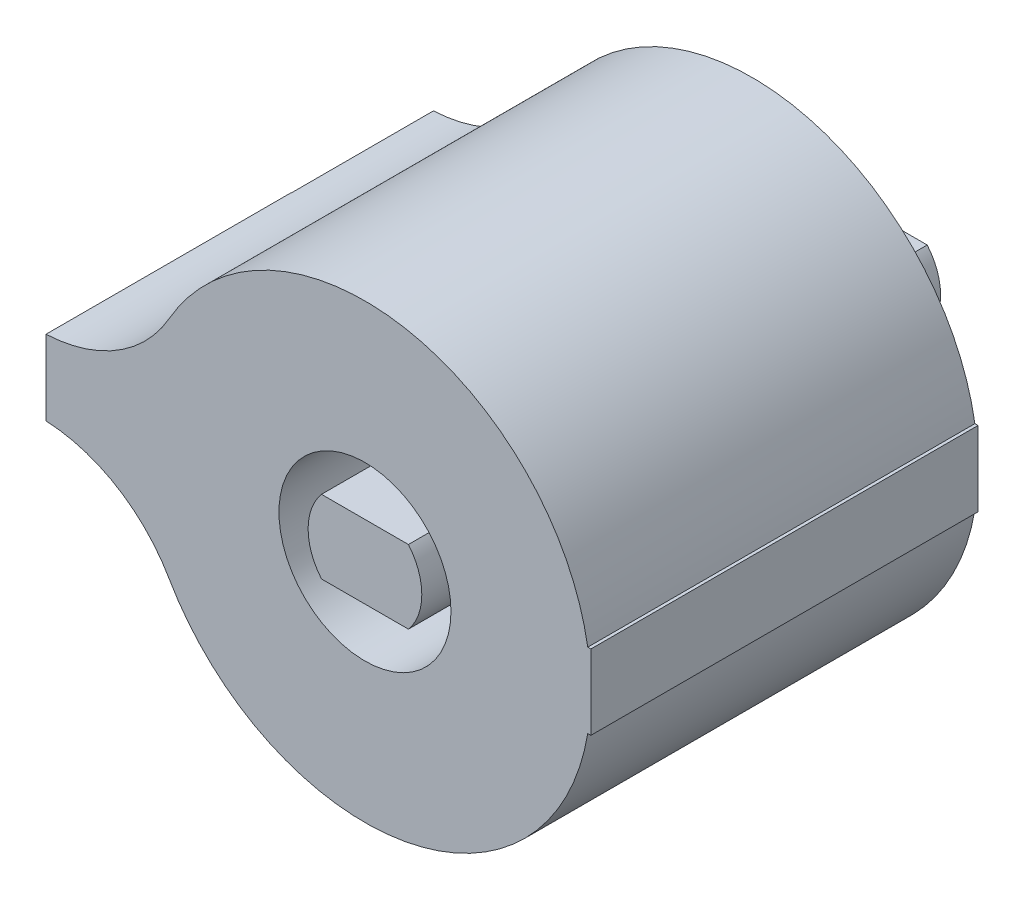
from build123d import *
from build123d.topology import SkipClean

# Parameters (mm, degrees)
SKETCH1_W                = 140
SKETCH1_H                = 90
BOSS_EXTRUDE1_DEPTH      = 2.5
SKETCH2_W                = 27.1
SKETCH2_H                = 30.8
SKETCH2_W_2              = 19.1
SKETCH2_H_2              = 22.8
BOSS_EXTRUDE2_DEPTH      = 40.6
SKETCH3_W                = 19.1
SKETCH3_H                = 22.8
BOSS_EXTRUDE3_DEPTH      = 4
CUT_EXTRUDE1_REACH       = 158.444
SKETCH4_W                = 5
SKETCH4_H                = 8
FILLET1_R                = 25
SKETCH5_W                = 38.1
SKETCH5_H                = 8
CUT_EXTRUDE2_DEPTH       = 39.6
CUT_EXTRUDE3_REACH       = 101.288
SKETCH6_W                = 55
SKETCH6_H                = 9.5
CUT_EXTRUDE4_REACH       = 135.898
SKETCH9_R                = 15.1
SKETCH9_R_2              = 11.1
BOSS_EXTRUDE4_DEPTH      = 7
SKETCH10_R               = 11.1
CUT_EXTRUDE5_DEPTH       = 7
SKETCH11_R               = 5.75
CUT_EXTRUDE6_DEPTH       = 76
BOSS_EXTRUDE5_DEPTH      = 76
SKETCH13_R               = 11.1
SKETCH13_R_2             = 5.75
BOSS_EXTRUDE6_DEPTH      = 76
SKETCH14_W               = 38.246600132
SKETCH14_H               = 12.6
CUT_EXTRUDE7_DEPTH       = 157.444143387
SKETCH15_R               = 3.8
BOSS_EXTRUDE7_DEPTH      = 90
SKETCH16_R               = 3.8
BOSS_EXTRUDE8_DEPTH      = 0.8
BOSS_EXTRUDE9_DEPTH      = 6
FILLET2_R                = 2
CHAMFER1_SIZE            = 1.6
FILLET3_R                = 10
FILLET4_R                = 5
CUT_EXTRUDE9_DEPTH       = 135.574774806
CUT_EXTRUDE10_DEPTH      = 157.444143476
CUT_EXTRUDE10_DEPTH_BACK = 157.444143476
SKETCH20_W               = 91.164780252
SKETCH20_H               = 36.856817744
CUT_EXTRUDE11_DEPTH      = 79.739570827
CUT_EXTRUDE11_DEPTH_BACK = 79.739570827
SKETCH21_W               = 114.516410758
SKETCH21_H               = 52.09205151
CUT_EXTRUDE12_DEPTH      = 6
BOSS_EXTRUDE10_DEPTH     = 8


# Read off the part's stored shape, not the designer's step: Mirror1
with BuildPart() as part:
    # Sketch1 → Boss-Extrude1 (new, symmetric)
    with BuildSketch(Plane(origin=(0, 0, 0), x_dir=(1, 0, 0), z_dir=(0, 1, 0))):
        Rectangle(SKETCH1_W, SKETCH1_H)
    extrude(amount=BOSS_EXTRUDE1_DEPTH, both=True)

    # Sketch2 → Boss-Extrude2 (add)
    with BuildSketch(Plane.ZY.offset(70)):
        with Locations((54.55, 0)):
            Rectangle(SKETCH2_W, SKETCH2_H)
        with Locations((54.55, 0)):
            Rectangle(SKETCH2_W_2, SKETCH2_H_2, mode=Mode.SUBTRACT)
    extrude(amount=-BOSS_EXTRUDE2_DEPTH)

    # Sketch3 → Boss-Extrude3 (add)
    with BuildSketch(Plane.ZY.offset(70)):
        with Locations((54.55, 0)):
            Rectangle(SKETCH3_W, SKETCH3_H)
    extrude(amount=-BOSS_EXTRUDE3_DEPTH)

    # Sketch4 → Cut-Extrude1 (cut, up to next)
    with BuildSketch(Plane.ZY.offset(70), mode=Mode.PRIVATE) as cut_extrude1_sk1:
        with Locations((54.55, 0)):
            Rectangle(SKETCH4_W, SKETCH4_H)
    cut_extrude1_tool1 = extrude(cut_extrude1_sk1.sketch, amount=-CUT_EXTRUDE1_REACH, mode=Mode.PRIVATE) & part.part
    add(cut_extrude1_tool1.solids().sort_by_distance((-70, 0, 54.55))[0], mode=Mode.SUBTRACT)

    # Fillet1
    # the kernel refuses this fillet: 25 mm, written as the material it adds along each edge
    with BuildSketch(Plane(origin=(-70, -2.5, 41), x_dir=(0, 0, -1), z_dir=(1, 0, 0))) as fillet1_piece_1:
        with BuildLine():
            CenterArc((21.876699934, -25), FILLET1_R, 90, 61.053024114)
            Line((0, -12.9), (-0.437533999, -12.658))
            ThreePointArc((-0.437533999, -12.658), (-0.5, -6.45), (-0.5, 0))
            Line((-0.5, 0), (0, 0.5))
            Line((0, 0.5), (21.876699934, 0.5))
            Line((21.876699934, 0.5), (21.876699934, 0))
        make_face()
    extrude(amount=40.6)
    with BuildSketch(Plane(origin=(-70, 2.5, 41), x_dir=(0, 0, -1), z_dir=(1, 0, 0))) as fillet1_piece_2:
        with BuildLine():
            CenterArc((21.876699934, 25), FILLET1_R, 208.946975886, 61.053024114)
            Line((0, 12.9), (-0.437533999, 12.658))
            ThreePointArc((-0.437533999, 12.658), (-0.5, 6.45), (-0.5, 0))
            Line((-0.5, 0), (0, -0.5))
            Line((0, -0.5), (21.876699934, -0.5))
            Line((21.876699934, -0.5), (21.876699934, 0))
        make_face()
    extrude(amount=40.6)

    # Sketch5 → Cut-Extrude2 (cut)
    with BuildSketch(Plane(origin=(-21.4, 0, 0), x_dir=(0, 0, -1), z_dir=(1, 0, 0))):
        with Locations((-54.55, 0)):
            Rectangle(SKETCH5_W, SKETCH5_H)
    extrude(amount=-CUT_EXTRUDE2_DEPTH, mode=Mode.SUBTRACT)

    # Sketch6 → Cut-Extrude3 (cut, up to next)
    with BuildSketch(Plane(origin=(0, 2.5, 0), x_dir=(1, 0, 0), z_dir=(0, 1, 0)), mode=Mode.PRIVATE) as cut_extrude3_sk1:
        with Locations((6.1, -40.25)):
            Rectangle(SKETCH6_W, SKETCH6_H)
    cut_extrude3_tool1 = extrude(cut_extrude3_sk1.sketch, amount=-CUT_EXTRUDE3_REACH, mode=Mode.PRIVATE) & part.part
    add(cut_extrude3_tool1.solids().sort_by_distance((6.1, 2.5, 40.25))[0], mode=Mode.SUBTRACT)

    # Sketch8 → Cut-Extrude4 (cut, up to next)
    with BuildSketch(Plane.XY.offset(68.1), mode=Mode.PRIVATE) as cut_extrude4_sk1:
        with BuildLine():
            Line((-58.5, 7.5), (-28.5, 7.5))
            ThreePointArc((-28.5, 7.5), (-21, 0), (-28.5, -7.5))
            Line((-28.5, -7.5), (-58.5, -7.5))
            ThreePointArc((-58.5, -7.5), (-66, 0), (-58.5, 7.5))
        make_face()
    cut_extrude4_tool1 = extrude(cut_extrude4_sk1.sketch, amount=-CUT_EXTRUDE4_REACH, mode=Mode.PRIVATE) & part.part
    add(cut_extrude4_tool1.solids().sort_by_distance((-43.5, 0, 68.1))[0], mode=Mode.SUBTRACT)

    # Mirror1
    split(bisect_by=Plane.XY, keep=Keep.TOP)

    # Mirror1 2: part across plane


with BuildPart() as part_1:
    add(part.part)
    add(part.part.mirror(Plane.XY))

    # Sketch9 → Boss-Extrude4 (add)
    with BuildSketch(Plane.XY.offset(45)):
        with Locations((54.9, 0)):
            Circle(SKETCH9_R)
        with Locations((54.9, 0)):
            Circle(SKETCH9_R_2, mode=Mode.SUBTRACT)
    boss_extrude4 = extrude(amount=-BOSS_EXTRUDE4_DEPTH)

    # Sketch10 → Cut-Extrude5 (cut)
    with BuildSketch(Plane.XY.offset(45)):
        with Locations((54.9, 0)):
            Circle(SKETCH10_R)
    cut_extrude5 = extrude(amount=-CUT_EXTRUDE5_DEPTH, mode=Mode.SUBTRACT)

    # Mirror2: Boss-Extrude4, Cut-Extrude5 across plane
    add(boss_extrude4.mirror(Plane.XY))
    add(cut_extrude5.mirror(Plane.XY), mode=Mode.SUBTRACT)

    # Sketch11 → Cut-Extrude6 (cut)
    with BuildSketch(Plane.XY.offset(38)):
        with Locations((54.9, 0)):
            Circle(SKETCH11_R)
    extrude(amount=-CUT_EXTRUDE6_DEPTH, mode=Mode.SUBTRACT)

    # Sketch12 → Boss-Extrude5 (add)
    with BuildSketch(Plane(origin=(0, 0, 38), x_dir=(-1, 0, 0), z_dir=(0, 0, -1))):
        with BuildLine():
            Line((-44.085195332, 2.5), (-40.008391625, 2.5))
            ThreePointArc((-40.008391625, 2.5), (-54.9, 15.1), (-69.791608375, 2.5))
            Line((-69.791608375, 2.5), (-65.714804668, 2.5))
            ThreePointArc((-65.714804668, 2.5), (-54.9, 11.1), (-44.085195332, 2.5))
        make_face()
        with BuildLine():
            Line((-40.008391625, -2.5), (-44.085195332, -2.5))
            ThreePointArc((-44.085195332, -2.5), (-54.9, -11.1), (-65.714804668, -2.5))
            Line((-65.714804668, -2.5), (-69.791608375, -2.5))
            ThreePointArc((-69.791608375, -2.5), (-54.9, -15.1), (-40.008391625, -2.5))
        make_face()
    extrude(amount=BOSS_EXTRUDE5_DEPTH)

    # Sketch13 → Boss-Extrude6 (add)
    with BuildSketch(Plane.XY.offset(38)):
        with Locations((54.9, 0)):
            Circle(SKETCH13_R)
        with Locations((54.9, 0)):
            Circle(SKETCH13_R_2, mode=Mode.SUBTRACT)
    extrude(amount=-BOSS_EXTRUDE6_DEPTH)

    # Sketch14 → Cut-Extrude7 (cut, through all)
    with BuildSketch(Plane.ZY.offset(70)):
        with Locations((0, 8.8)):
            Rectangle(SKETCH14_W, SKETCH14_H)
    extrude(amount=-CUT_EXTRUDE7_DEPTH, mode=Mode.SUBTRACT)

    # Fillet2
    fillet2_edges = [part_1.edges().sort_by_distance(p)[0] for p in [
        (-49.7, 15.4, -68.1),
        (-49.7, 15.4, -41),
        (-49.7, -15.4, -41),
        (-49.7, -15.4, -68.1),
        (-49.7, -15.4, 41),
        (-49.7, 15.4, 41),
        (-49.7, 15.4, 68.1),
        (-49.7, -15.4, 68.1),
    ]]
    fillet(fillet2_edges, radius=FILLET2_R)

    # Chamfer1
    chamfer1_edges = [part_1.edges().sort_by_distance(p)[0] for p in [
        (-43.95, 7.5, 68.1),
        (-66, 0, 68.1),
        (-43.95, -7.5, 68.1),
        (-43.95, 7.5, -68.1),
        (-43.95, -7.5, -68.1),
        (-66, 0, -68.1),
    ]]
    chamfer(chamfer1_edges, length=CHAMFER1_SIZE)

    # Fillet3
    # the kernel refuses this fillet: 10 mm, written as the material it adds along each edge
    with BuildSketch(Plane(origin=(40.008391625, -2.5, 38), x_dir=(0.3370807355447674, -0.9414757446289301, 0), z_dir=(0, 0, -1))) as fillet3_piece_1_section:
        with BuildLine():
            CenterArc((7.097522828, 9.842907234), FILLET3_R, 199.699116173, 60.131704489)
            Line((-2.317234618, 6.472099878), (0, 0))
            ThreePointArc((0, 0), (2.665984943, 0.237210077), (5.331969886, 0))
        make_face()
    fillet3_piece_1 = extrude(amount=76, mode=Mode.PRIVATE)
    fillet3_piece_1 = split(fillet3_piece_1, bisect_by=Plane(origin=(33.6, -3.612944969, 36.75), z_dir=(1, 0, 0)), keep=Keep.TOP, mode=Mode.PRIVATE)
    add(fillet3_piece_1)
    with BuildSketch(Plane(origin=(40.008391625, -2.5, 38), x_dir=(0.3370807355447674, -0.9414757446289301, 0), z_dir=(0, 0, -1))) as fillet3_piece_2_section:
        with BuildLine():
            CenterArc((7.097522828, 9.842907234), FILLET3_R, 199.699116173, 60.131704489)
            Line((-2.317234618, 6.472099878), (0, 0))
            ThreePointArc((0, 0), (2.665984943, 0.237210077), (5.331969886, 0))
        make_face()
    fillet3_piece_2 = extrude(amount=76, mode=Mode.PRIVATE)
    fillet3_piece_2 = split(fillet3_piece_2, bisect_by=Plane(origin=(33.483505518, -2.503259206, 35.5), z_dir=(0, 0, -1)), keep=Keep.TOP, mode=Mode.PRIVATE)
    fillet3_piece_2 = split(fillet3_piece_2, bisect_by=Plane(origin=(33.483505518, -2.503259206, -35.5), z_dir=(0, 0, 1)), keep=Keep.TOP, mode=Mode.PRIVATE)
    add(fillet3_piece_2)
    with BuildSketch(Plane(origin=(40.008391625, 2.5, -19.123300066), x_dir=(0.3370807355447668, 0.9414757446289305, 0), z_dir=(0, 0, -1))) as fillet3_piece_3_section:
        with BuildLine():
            CenterArc((7.097522828, -9.842907234), FILLET3_R, 100.169179339, 60.131704489)
            Line((-2.317234618, -6.472099878), (0, 0))
            ThreePointArc((0, 0), (2.665984943, -0.237210077), (5.331969886, 0))
        make_face()
    fillet3_piece_3 = extrude(amount=43.062750438, mode=Mode.PRIVATE)
    fillet3_piece_3 = split(fillet3_piece_3, bisect_by=Plane(origin=(38.74616156, 3.612944969, -35.5), z_dir=(0, 0, 1)), keep=Keep.TOP, mode=Mode.PRIVATE)
    add(fillet3_piece_3)
    with BuildSketch(Plane(origin=(40.008391625, 2.5, -19.123300066), x_dir=(0.3370807355447668, 0.9414757446289305, 0), z_dir=(0, 0, -1))) as fillet3_piece_4_section:
        with BuildLine():
            CenterArc((7.097522828, -9.842907234), FILLET3_R, 100.169179339, 60.131704489)
            Line((-2.317234618, -6.472099878), (0, 0))
            ThreePointArc((0, 0), (2.665984943, -0.237210077), (5.331969886, 0))
        make_face()
    fillet3_piece_4 = extrude(amount=25.876699934, mode=Mode.PRIVATE)
    fillet3_piece_4 = split(fillet3_piece_4, bisect_by=Plane(origin=(33.6, 3.612944969, -40.25), z_dir=(1, 0, 0)), keep=Keep.TOP, mode=Mode.PRIVATE)
    add(fillet3_piece_4)
    with BuildSketch(Plane(origin=(40.008391625, 2.5, 45), x_dir=(0.3370807355447668, 0.9414757446289305, 0), z_dir=(0, 0, -1))) as fillet3_piece_5_section:
        with BuildLine():
            CenterArc((7.097522828, -9.842907234), FILLET3_R, 100.169179339, 60.131704489)
            Line((-2.317234618, -6.472099878), (0, 0))
            ThreePointArc((0, 0), (2.665984943, -0.237210077), (5.331969886, 0))
        make_face()
    fillet3_piece_5 = extrude(amount=25.876699934, mode=Mode.PRIVATE)
    fillet3_piece_5 = split(fillet3_piece_5, bisect_by=Plane(origin=(33.6, 3.612944969, 40.25), z_dir=(1, 0, 0)), keep=Keep.TOP, mode=Mode.PRIVATE)
    add(fillet3_piece_5)
    with BuildSketch(Plane(origin=(40.008391625, 2.5, 62.186050504), x_dir=(0.3370807355447676, 0.9414757446289301, 0), z_dir=(0, 0, -1))) as fillet3_piece_6_section:
        with BuildLine():
            CenterArc((7.097522828, -9.842907234), FILLET3_R, 100.169179339, 60.131704489)
            Line((-2.317234618, -6.472099878), (0, 0))
            ThreePointArc((0, 0), (2.665984943, -0.237210077), (5.331969886, 0))
        make_face()
    fillet3_piece_6 = extrude(amount=43.062750438, mode=Mode.PRIVATE)
    fillet3_piece_6 = split(fillet3_piece_6, bisect_by=Plane(origin=(33.483505518, 2.503259206, 35.5), z_dir=(0, 0, -1)), keep=Keep.TOP, mode=Mode.PRIVATE)
    add(fillet3_piece_6)
    with BuildSketch(Plane(origin=(40.008391625, -2.5, 38), x_dir=(0.3370807355447675, -0.9414757446289301, 0), z_dir=(0, 0, 1))) as fillet3_piece_7_section:
        with BuildLine():
            CenterArc((7.097522828, -9.842907234), FILLET3_R, 100.169179339, 60.131704489)
            Line((-2.317234618, -6.472099878), (0, 0))
            ThreePointArc((0, 0), (2.665984943, -0.237210077), (5.331969886, 0))
        make_face()
    fillet3_piece_7 = extrude(amount=7, mode=Mode.PRIVATE)
    fillet3_piece_7 = split(fillet3_piece_7, bisect_by=Plane(origin=(33.6, -3.612944969, 41.5), z_dir=(1, 0, 0)), keep=Keep.TOP, mode=Mode.PRIVATE)
    add(fillet3_piece_7)
    with BuildSketch(Plane(origin=(40.008391625, -2.5, -38), x_dir=(0.3370807355447675, -0.9414757446289301, 0), z_dir=(0, 0, -1))) as fillet3_piece_8_section:
        with BuildLine():
            CenterArc((7.097522828, 9.842907234), FILLET3_R, 199.699116173, 60.131704489)
            Line((-2.317234618, 6.472099878), (0, 0))
            ThreePointArc((0, 0), (2.665984943, 0.237210077), (5.331969886, 0))
        make_face()
    fillet3_piece_8 = extrude(amount=7, mode=Mode.PRIVATE)
    fillet3_piece_8 = split(fillet3_piece_8, bisect_by=Plane(origin=(33.6, -3.612944969, -41.5), z_dir=(1, 0, 0)), keep=Keep.TOP, mode=Mode.PRIVATE)
    add(fillet3_piece_8)

    # Fillet4
    fillet4_edges = [part_1.edges().sort_by_distance(p)[0] for p in [
        (-29.4, -2.5, -27.311650033),
        (-29.4, 2.5, -27.311650033),
        (-29.4, 2.5, 27.311650033),
        (-29.4, -2.5, 27.311650033),
    ]]
    fillet(fillet4_edges, radius=FILLET4_R)


with BuildPart() as body_2:
    # Sketch15 → Boss-Extrude7 (new body)
    with BuildSketch(Plane(origin=(0, 0, -45), x_dir=(-1, 0, 0), z_dir=(0, 0, -1))):
        with Locations((-54.9, 0)):
            Circle(SKETCH15_R)
    extrude(amount=-BOSS_EXTRUDE7_DEPTH)

    # Sketch16 → Boss-Extrude8 (add)
    with BuildSketch(Plane(origin=(0, 0, -45), x_dir=(-1, 0, 0), z_dir=(0, 0, -1))):
        with Locations((-54.9, 0)):
            Circle(SKETCH16_R)
    boss_extrude8 = extrude(amount=BOSS_EXTRUDE8_DEPTH)

    # Sketch17 → Boss-Extrude9 (add)
    with BuildSketch(Plane(origin=(0, 0, -45.8), x_dir=(-1, 0, 0), z_dir=(0, 0, -1))):
        with BuildLine():
            Line((-57.672634127, -2.45), (-52.127365873, -2.45))
            ThreePointArc((-52.127365873, -2.45), (-51.2, 0), (-52.127365873, 2.45))
            Line((-52.127365873, 2.45), (-57.672634127, 2.45))
            ThreePointArc((-57.672634127, 2.45), (-58.6, 0), (-57.672634127, -2.45))
        make_face()
    boss_extrude9 = extrude(amount=BOSS_EXTRUDE9_DEPTH)

    # Mirror3: Boss-Extrude8, Boss-Extrude9 across plane
    add(boss_extrude8.mirror(Plane.XY))
    add(boss_extrude9.mirror(Plane.XY))

    # Sketch19 → Cut-Extrude9 (cut, through all)
    with BuildSketch(Plane(origin=(0, 0, -45.8), x_dir=(-1, 0, 0), z_dir=(0, 0, -1))):
        with BuildLine():
            Line((-52.127365873, 2.45), (-51.99526249, 2.45))
            ThreePointArc((-51.99526249, 2.45), (-54.9, 3.8), (-57.80473751, 2.45))
            Line((-57.80473751, 2.45), (-57.672634127, 2.45))
            Line((-57.672634127, 2.45), (-52.127365873, 2.45))
        make_face()
        with BuildLine():
            ThreePointArc((-57.80473751, -2.45), (-54.9, -3.8), (-51.99526249, -2.45))
            Line((-51.99526249, -2.45), (-52.127365873, -2.45))
            Line((-52.127365873, -2.45), (-57.672634127, -2.45))
            Line((-57.672634127, -2.45), (-57.80473751, -2.45))
        make_face()
    extrude(amount=-CUT_EXTRUDE9_DEPTH, mode=Mode.SUBTRACT)


with BuildPart() as cut_extrude10_tool:
    # Sketch20 → Cut-Extrude10 (new, two sides: drawn at the far end of the back side and taken through both)
    with BuildSketch(Plane(origin=(70, 0, 0), x_dir=(0, 0, -1), z_dir=(1, 0, 0)).offset(-CUT_EXTRUDE10_DEPTH_BACK)):
        with Locations((-26.45909006, 0.418827474)):
            Rectangle(SKETCH20_W, SKETCH20_H)
    extrude(amount=CUT_EXTRUDE10_DEPTH + CUT_EXTRUDE10_DEPTH_BACK)


with BuildPart() as part_2:
    add(part_1.part)

    # Cut-Extrude10: cut by cut_extrude10_tool
    add(cut_extrude10_tool.part, mode=Mode.SUBTRACT)

    # Sketch21 → Cut-Extrude11 (cut, two sides: drawn at the far end of the back side and taken through both)
    with BuildSketch(Plane(origin=(0, 0, -35.5), x_dir=(-1, 0, 0), z_dir=(0, 0, -1)).offset(-CUT_EXTRUDE11_DEPTH_BACK)):
        with Locations((23.678205232, -4.663888909)):
            Rectangle(SKETCH21_W, SKETCH21_H)
    extrude(amount=CUT_EXTRUDE11_DEPTH + CUT_EXTRUDE11_DEPTH_BACK, mode=Mode.SUBTRACT)


with BuildPart() as body_2_1:
    add(body_2.part)

    # Cut-Extrude10: cut by cut_extrude10_tool
    add(cut_extrude10_tool.part, mode=Mode.SUBTRACT)

    # Sketch22 → Cut-Extrude12 (cut)
    with BuildSketch(Plane(origin=(0, 0, -51.8), x_dir=(-1, 0, 0), z_dir=(0, 0, -1))):
        with BuildLine():
            Line((-57.672634127, -2.45), (-52.127365873, -2.45))
            ThreePointArc((-52.127365873, -2.45), (-51.2, 0), (-52.127365873, 2.45))
            Line((-52.127365873, 2.45), (-57.672634127, 2.45))
            ThreePointArc((-57.672634127, 2.45), (-58.6, 0), (-57.672634127, -2.45))
        make_face()
    extrude(amount=-CUT_EXTRUDE12_DEPTH, mode=Mode.SUBTRACT)

    # Sketch23 → Boss-Extrude10 (add)
    with SkipClean():  # the faces are left unmerged after this step: merging them gives an invalid solid
        with BuildSketch(Plane(origin=(0, 0, -45.8), x_dir=(-1, 0, 0), z_dir=(0, 0, -1))):
            with BuildLine():
                Line((-57.80473751, -2.45), (-51.99526249, -2.45))
                ThreePointArc((-51.99526249, -2.45), (-51.1, 0), (-51.99526249, 2.45))
                Line((-51.99526249, 2.45), (-57.80473751, 2.45))
                ThreePointArc((-57.80473751, 2.45), (-58.7, 0), (-57.80473751, -2.45))
            make_face()
        extrude(amount=BOSS_EXTRUDE10_DEPTH)


solid = Compound([part_2.part, body_2_1.part])
